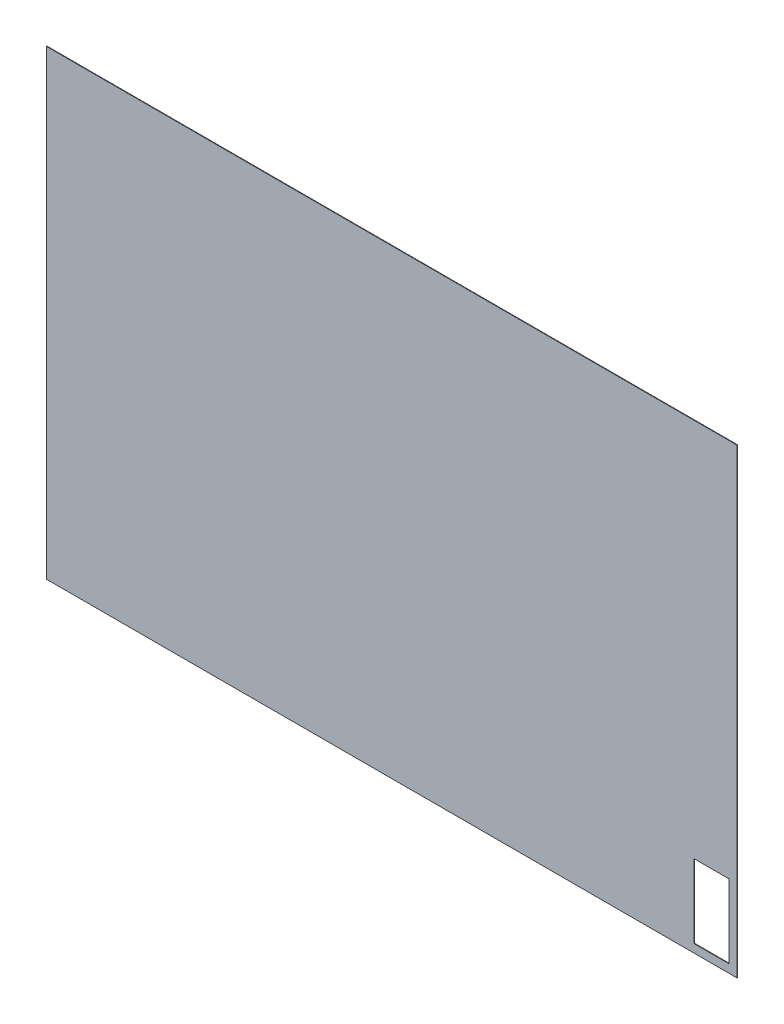
from build123d import *

# Parameters (mm, degrees)
SKETCH1_W           = 2500
SKETCH1_H           = 1670
SKETCH1_W_2         = 126
SKETCH1_H_2         = 266
BOSS_EXTRUDE1_DEPTH = 2


with BuildPart() as part:
    # Sketch1 → Boss-Extrude1 (new body)
    with BuildSketch(Plane.XY):
        with Locations((1250, 835)):
            Rectangle(SKETCH1_W, SKETCH1_H)
        with Locations((2407, 163)):
            Rectangle(SKETCH1_W_2, SKETCH1_H_2, mode=Mode.SUBTRACT)
    extrude(amount=BOSS_EXTRUDE1_DEPTH)


solid = part.part
